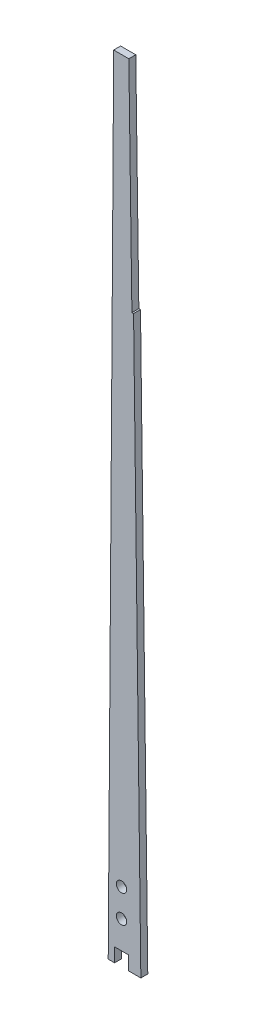
from build123d import *

# Parameters (mm, degrees)
BOSS_EXTRUDE2_DEPTH             = 3.175
CUT_EXTRUDE1_DEPTH              = 401.159235389
CUT_EXTRUDE2_DEPTH              = 401.15653942
F_3_16_0_1875_DOWEL_HOLE1_D     = 4.7625
F_3_16_0_1875_DOWEL_HOLE1_DEPTH = 10.668
F_3_16_0_1875_DOWEL_HOLE1_TIP   = 1.430799349


with BuildPart() as part:
    # Sketch4 → Boss-Extrude2 (new body)
    with BuildSketch(Plane.XY):
        with BuildLine():
            Line((6.144188466, 399.996), (-1.564628202, 399.996))
            add(Edge.make_bspline(
                [(-1.564628202, 399.996), (-1.637174788, 388.71620979), (-1.710838898, 377.436426734), (-1.931030055, 344.124623438), (-2.080195275, 322.071076558), (-2.231295485, 300.017543047), (-2.231443089, 299.996)],
                knots=[0, 0, 0, 0, 0.338393179, 0.338393179, 0.999353708, 1, 1, 1, 1], degree=3))
            add(Edge.make_bspline(
                [(-2.231443089, 299.996), (-2.234910001, 299.490015836), (-2.392998432, 276.424514526), (-2.553149089, 253.359027396), (-2.868339074, 208.240034357), (-3.026919098, 185.680544746), (-3.346358338, 140.30004638), (-3.655597038, 96.420691856), (-3.96272456, 52.54132248), (-4.109198909, 31.482963398)],
                knots=[0, 0, 0, 0, 0.005653174, 0.257702337, 0.257702337, 0.509751499, 0.509751499, 0.764722557, 1, 1, 1, 1], degree=3))
            ThreePointArc((-4.109198909, 31.482963398), (3.537371824, 31.552329559), (10.978749619, 29.791434286))
            add(Edge.make_bspline(
                [(10.978749619, 29.791434286), (9.910858694, 119.860572239), (8.773292587, 209.928893381), (7.546161517, 299.996)],
                knots=[0, 0, 0, 0, 1, 1, 1, 1], degree=3))
            add(Edge.make_bspline(
                [(7.546161517, 299.996), (7.092002873, 333.329517913), (6.623807366, 366.662839033), (6.144188466, 399.996)],
                knots=[0, 0, 0, 0, 1, 1, 1, 1], degree=3))
        make_face()
    extrude(amount=BOSS_EXTRUDE2_DEPTH)

    # Sketch5 → Cut-Extrude1 (cut, through all)
    with BuildSketch(Plane.XY):
        Polygon((-7.827985121, 0), (14.650850585, 0), (14.650850585, 38.1), (5.207, 38.1), (5.207, 44.45), (-1.143, 44.45), (-1.143, 38.1), (-7.827985121, 38.1), align=None)
    extrude(amount=CUT_EXTRUDE1_DEPTH, mode=Mode.SUBTRACT)

    # Sketch6 → Cut-Extrude2 (cut, through all)
    with BuildSketch(Plane.XY.offset(3.175)):
        Polygon((6.144188466, 399.996), (7.546027637, 300.005826248), (6.784177382, 299.995145283), (5.382188466, 399.996), align=None)
    extrude(amount=-CUT_EXTRUDE2_DEPTH, mode=Mode.SUBTRACT)


with BuildPart() as cut_extrude2_kept_piece:
    # of the separate pieces the step leaves, the one the design keeps (cut_extrude2_pieces_kept)
    add(part.part.solids().sort_by_distance((5.382188466, 399.996, 0))[0])

    # 3/16 (0.1875) Dowel Hole1
    with Locations(Plane.XY.offset(3.175)):
        with Locations((2.032, 57.15), (2.032, 69.85)):
            Hole(F_3_16_0_1875_DOWEL_HOLE1_D / 2, depth=F_3_16_0_1875_DOWEL_HOLE1_DEPTH)
            with Locations((0, 0, -(F_3_16_0_1875_DOWEL_HOLE1_DEPTH + F_3_16_0_1875_DOWEL_HOLE1_TIP / 2))):  # 118° drill point
                Cone(0, F_3_16_0_1875_DOWEL_HOLE1_D / 2, F_3_16_0_1875_DOWEL_HOLE1_TIP, mode=Mode.SUBTRACT)


solid = cut_extrude2_kept_piece.part
